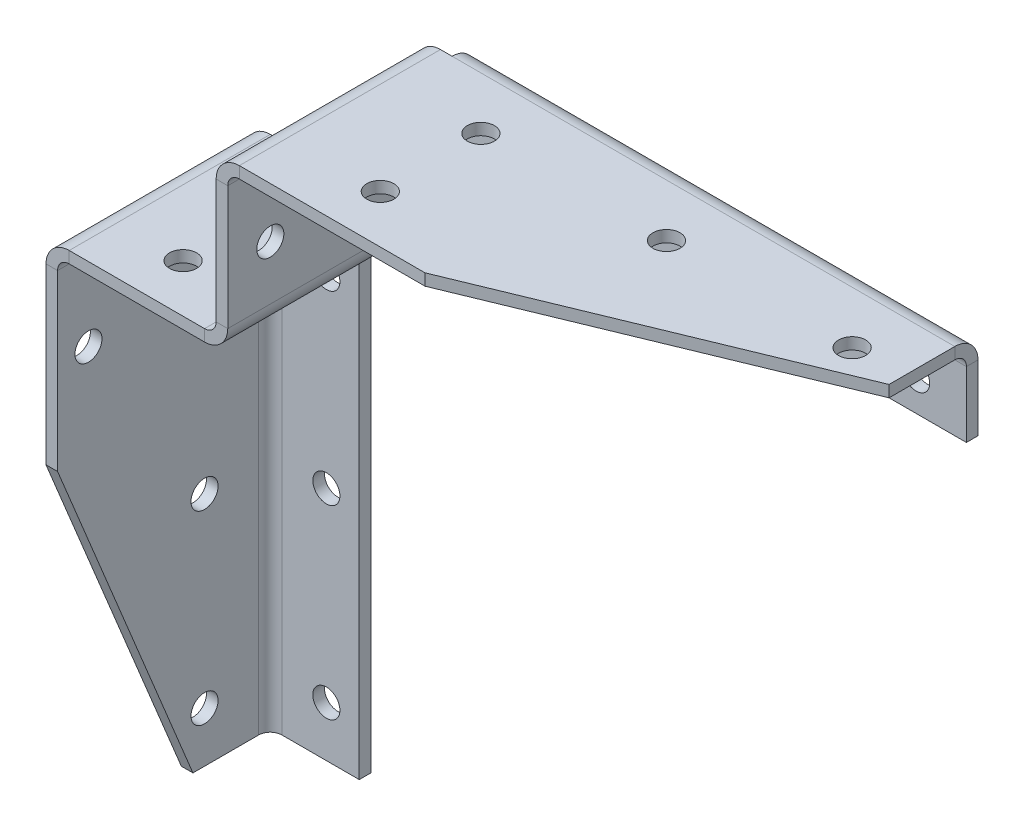
from build123d import *

# Parameters (mm, degrees)
SM_BASE_FLANGE_1_DEPTH           = 3
SM_EDGE_FLANGE_1_STRIP_W         = 18
SM_EDGE_FLANGE_1_STRIP_H         = 3
SM_EDGE_FLANGE_1_STRIP_CUT_DEPTH = 130
SM_EDGE_FLANGE_1_DEPTH           = 130
SM_EDGE_FLANGE_2_DEPTH           = 52
SM_EDGE_FLANGE_5_DEPTH           = 52
CUT_EXTRUDE_2_REACH              = 158.911
SKETCH_48_R                      = 3.5
CUT_EXTRUDE_3_REACH              = 150.997
SKETCH_49_R                      = 3.5
CUT_EXTRUDE_4_REACH              = 150.997
SKETCH_51_R                      = 3.5
SM_EDGE_FLANGE_6_DEPTH           = 52
CUT_EXTRUDE_5_REACH              = 263.117
SKETCH_59_R                      = 3.5
SM_EDGE_FLANGE_8_DEPTH           = 130
CUT_EXTRUDE_6_REACH              = 229.141
SKETCH_68_R                      = 3.5
CUT_EXTRUDE_7_REACH              = 198.876
SKETCH_69_R                      = 3.5


# Sheet-metal steps are written as plain solids
with BuildPart() as part:
    # Sketch 2 → Базовая кромка1 (new body)
    with BuildSketch(Plane(origin=(0, 0, 0), x_dir=(1, 0, 0), z_dir=(0, 1, 0))):
        Polygon((45, 55), (130, 55), (130, 35), (45, 0), (0, 0), (0, 55), align=None)
    extrude(amount=-SM_BASE_FLANGE_1_DEPTH)

    # Ребро-кромка1 strip (across the edge) → Ребро-кромка1 strip cut (cut)
    with BuildSketch(Plane(origin=(0, -3, -55), x_dir=(0, 0, 1), z_dir=(1, 0, 0))):
        with Locations((-6, -1.5)):
            Rectangle(SM_EDGE_FLANGE_1_STRIP_W, SM_EDGE_FLANGE_1_STRIP_H)
    extrude(amount=SM_EDGE_FLANGE_1_STRIP_CUT_DEPTH, mode=Mode.SUBTRACT)

    # Ребро-кромка1 section (across the edge) → Ребро-кромка1 (add)
    with BuildSketch(Plane(origin=(0, -3, -55), x_dir=(0, 0, 1), z_dir=(1, 0, 0))):
        with BuildLine():
            Line((-3, 3), (-3, 20))
            Line((-3, 20), (0, 20))
            Line((0, 20), (0, 3))
            ThreePointArc((0, 3), (0.878679656, 0.878679656), (3, 0))
            Line((3, 0), (3, -3))
            ThreePointArc((3, -3), (-1.242640687, -1.242640687), (-3, 3))
        make_face()
    extrude(amount=SM_EDGE_FLANGE_1_DEPTH)

    # Ребро-кромка2 section (across the edge) → Ребро-кромка2 (add)
    with BuildSketch(Plane(origin=(-6, -3, 0), x_dir=(1, 0, 0), z_dir=(0, 0, -1))):
        with BuildLine():
            Line((-3, 3), (-3, 35))
            Line((-3, 35), (0, 35))
            Line((0, 35), (0, 3))
            ThreePointArc((0, 3), (0.878679656, 0.878679656), (3, 0))
            Line((3, 0), (6, 0))
            Line((6, 0), (6, -3))
            Line((6, -3), (3, -3))
            ThreePointArc((3, -3), (-1.242640687, -1.242640687), (-3, 3))
        make_face()
    extrude(amount=SM_EDGE_FLANGE_2_DEPTH)

    # Ребро-кромка5 section (across the edge) → Ребро-кромка5 (add)
    with BuildSketch(Plane(origin=(-9, -41, -52), x_dir=(0, 1, 0), z_dir=(0, 0, 1))):
        with BuildLine():
            Line((-3, 3), (-3, 38))
            Line((-3, 38), (0, 38))
            Line((0, 38), (0, 3))
            ThreePointArc((0, 3), (0.878679656, 0.878679656), (3, 0))
            Line((3, 0), (3, -3))
            ThreePointArc((3, -3), (-1.242640687, -1.242640687), (-3, 3))
        make_face()
    extrude(amount=SM_EDGE_FLANGE_5_DEPTH)

    # Эскиз48 → Вырез-Вытянуть2 (cut, up to next)
    with BuildSketch(Plane.ZY.offset(9), mode=Mode.PRIVATE) as cut_extrude_2_sk1:
        with Locations(Location((-41, -24, 0), (0, 0, 270))):
            Circle(SKETCH_48_R)
    cut_extrude_2_tool1 = extrude(cut_extrude_2_sk1.sketch, amount=-CUT_EXTRUDE_2_REACH, mode=Mode.PRIVATE) & part.part
    # Эскиз48 → Вырез-Вытянуть2 (cut, up to next)
    with BuildSketch(Plane.ZY.offset(9), mode=Mode.PRIVATE) as cut_extrude_2_sk2:
        with Locations(Location((-11, -24, 0), (0, 0, 270))):
            Circle(SKETCH_48_R)
    cut_extrude_2_tool2 = extrude(cut_extrude_2_sk2.sketch, amount=-CUT_EXTRUDE_2_REACH, mode=Mode.PRIVATE) & part.part
    add(cut_extrude_2_tool1.solids().sort_by_distance((-9, -24, -41))[0], mode=Mode.SUBTRACT)
    add(cut_extrude_2_tool2.solids().sort_by_distance((-9, -24, -11))[0], mode=Mode.SUBTRACT)

    # Эскиз49 → Вырез-Вытянуть3 (cut, up to next)
    with BuildSketch(Plane(origin=(0, 0, 0), x_dir=(1, 0, 0), z_dir=(0, 1, 0)), mode=Mode.PRIVATE) as cut_extrude_3_sk1:
        with Locations(Location((21, 12.448418776, 0), (0, 0, 270))):
            Circle(SKETCH_49_R)
    cut_extrude_3_tool1 = extrude(cut_extrude_3_sk1.sketch, amount=-CUT_EXTRUDE_3_REACH, mode=Mode.PRIVATE) & part.part
    # Эскиз49 → Вырез-Вытянуть3 (cut, up to next)
    with BuildSketch(Plane(origin=(0, 0, 0), x_dir=(1, 0, 0), z_dir=(0, 1, 0)), mode=Mode.PRIVATE) as cut_extrude_3_sk2:
        with Locations(Location((21, 38.45, 0), (0, 0, 270))):
            Circle(SKETCH_49_R)
    cut_extrude_3_tool2 = extrude(cut_extrude_3_sk2.sketch, amount=-CUT_EXTRUDE_3_REACH, mode=Mode.PRIVATE) & part.part
    # Эскиз49 → Вырез-Вытянуть3 (cut, up to next)
    with BuildSketch(Plane(origin=(0, 0, 0), x_dir=(1, 0, 0), z_dir=(0, 1, 0)), mode=Mode.PRIVATE) as cut_extrude_3_sk3:
        with Locations(Location((117, 38.45, 0), (0, 0, 270))):
            Circle(SKETCH_49_R)
    cut_extrude_3_tool3 = extrude(cut_extrude_3_sk3.sketch, amount=-CUT_EXTRUDE_3_REACH, mode=Mode.PRIVATE) & part.part
    # Эскиз49 → Вырез-Вытянуть3 (cut, up to next)
    with BuildSketch(Plane(origin=(0, 0, 0), x_dir=(1, 0, 0), z_dir=(0, 1, 0)), mode=Mode.PRIVATE) as cut_extrude_3_sk4:
        with Locations(Location((69, 38.45, 0), (0, 0, 270))):
            Circle(SKETCH_49_R)
    cut_extrude_3_tool4 = extrude(cut_extrude_3_sk4.sketch, amount=-CUT_EXTRUDE_3_REACH, mode=Mode.PRIVATE) & part.part
    add(cut_extrude_3_tool1.solids().sort_by_distance((21, 0, -12.448419))[0], mode=Mode.SUBTRACT)
    add(cut_extrude_3_tool2.solids().sort_by_distance((21, 0, -38.45))[0], mode=Mode.SUBTRACT)
    add(cut_extrude_3_tool3.solids().sort_by_distance((117, 0, -38.45))[0], mode=Mode.SUBTRACT)
    add(cut_extrude_3_tool4.solids().sort_by_distance((69, 0, -38.45))[0], mode=Mode.SUBTRACT)

    # Эскиз51 → Вырез-Вытянуть4 (cut, up to next)
    with BuildSketch(Plane(origin=(0, 0, -58), x_dir=(-1, 0, 0), z_dir=(0, 0, -1)), mode=Mode.PRIVATE) as cut_extrude_4_sk1:
        with Locations(Location((-117, -14.5, 0), (0, 0, 90))):
            Circle(SKETCH_51_R)
    cut_extrude_4_tool1 = extrude(cut_extrude_4_sk1.sketch, amount=-CUT_EXTRUDE_4_REACH, mode=Mode.PRIVATE) & part.part
    # Эскиз51 → Вырез-Вытянуть4 (cut, up to next)
    with BuildSketch(Plane(origin=(0, 0, -58), x_dir=(-1, 0, 0), z_dir=(0, 0, -1)), mode=Mode.PRIVATE) as cut_extrude_4_sk2:
        with Locations(Location((-69, -14.5, 0), (0, 0, 90))):
            Circle(SKETCH_51_R)
    cut_extrude_4_tool2 = extrude(cut_extrude_4_sk2.sketch, amount=-CUT_EXTRUDE_4_REACH, mode=Mode.PRIVATE) & part.part
    # Эскиз51 → Вырез-Вытянуть4 (cut, up to next)
    with BuildSketch(Plane(origin=(0, 0, -58), x_dir=(-1, 0, 0), z_dir=(0, 0, -1)), mode=Mode.PRIVATE) as cut_extrude_4_sk3:
        with Locations(Location((-21, -14.5, 0), (0, 0, 90))):
            Circle(SKETCH_51_R)
    cut_extrude_4_tool3 = extrude(cut_extrude_4_sk3.sketch, amount=-CUT_EXTRUDE_4_REACH, mode=Mode.PRIVATE) & part.part
    add(cut_extrude_4_tool1.solids().sort_by_distance((117, -14.5, -58))[0], mode=Mode.SUBTRACT)
    add(cut_extrude_4_tool2.solids().sort_by_distance((69, -14.5, -58))[0], mode=Mode.SUBTRACT)
    add(cut_extrude_4_tool3.solids().sort_by_distance((21, -14.5, -58))[0], mode=Mode.SUBTRACT)

    # Ребро-кромка6 section (across the edge) → Ребро-кромка6 (add)
    with BuildSketch(Plane(origin=(-50, -44, 0), x_dir=(1, 0, 0), z_dir=(0, 0, -1))):
        with BuildLine():
            Line((-3, 3), (-3, 133))
            Line((-3, 133), (0, 133))
            Line((0, 133), (0, 3))
            ThreePointArc((0, 3), (0.878679656, 0.878679656), (3, 0))
            Line((3, 0), (3, -3))
            ThreePointArc((3, -3), (-1.242640687, -1.242640687), (-3, 3))
        make_face()
    extrude(amount=SM_EDGE_FLANGE_6_DEPTH)

    # Эскиз59 → Вырез-Вытянуть5 (cut, up to next)
    with BuildSketch(Plane.ZY.offset(53), mode=Mode.PRIVATE) as cut_extrude_5_sk1:
        with Locations(Location((-7.981818004, -68, 0), (0, 0, 270))):
            Circle(SKETCH_59_R)
    cut_extrude_5_tool1 = extrude(cut_extrude_5_sk1.sketch, amount=-CUT_EXTRUDE_5_REACH, mode=Mode.PRIVATE) & part.part
    # Эскиз59 → Вырез-Вытянуть5 (cut, up to next)
    with BuildSketch(Plane.ZY.offset(53), mode=Mode.PRIVATE) as cut_extrude_5_sk2:
        with Locations(Location((-37.994919226, -68, 0), (0, 0, 270))):
            Circle(SKETCH_59_R)
    cut_extrude_5_tool2 = extrude(cut_extrude_5_sk2.sketch, amount=-CUT_EXTRUDE_5_REACH, mode=Mode.PRIVATE) & part.part
    # Эскиз59 → Вырез-Вытянуть5 (cut, up to next)
    with BuildSketch(Plane.ZY.offset(53), mode=Mode.PRIVATE) as cut_extrude_5_sk3:
        with Locations(Location((-37.994919226, -116, 0), (0, 0, 270))):
            Circle(SKETCH_59_R)
    cut_extrude_5_tool3 = extrude(cut_extrude_5_sk3.sketch, amount=-CUT_EXTRUDE_5_REACH, mode=Mode.PRIVATE) & part.part
    # Эскиз59 → Вырез-Вытянуть5 (cut, up to next)
    with BuildSketch(Plane.ZY.offset(53), mode=Mode.PRIVATE) as cut_extrude_5_sk4:
        with Locations(Location((-37.994919226, -164, 0), (0, 0, 270))):
            Circle(SKETCH_59_R)
    cut_extrude_5_tool4 = extrude(cut_extrude_5_sk4.sketch, amount=-CUT_EXTRUDE_5_REACH, mode=Mode.PRIVATE) & part.part
    # Эскиз59 → Вырез-Вытянуть5 (cut, up to next)
    with BuildSketch(Plane.ZY.offset(53), mode=Mode.PRIVATE) as cut_extrude_5_sk5:
        Polygon((0, -92), (-35, -177), (0, -177), align=None)
    cut_extrude_5_tool5 = extrude(cut_extrude_5_sk5.sketch, amount=-CUT_EXTRUDE_5_REACH, mode=Mode.PRIVATE) & part.part
    add(cut_extrude_5_tool1.solids().sort_by_distance((-53, -68, -7.981818))[0], mode=Mode.SUBTRACT)
    add(cut_extrude_5_tool2.solids().sort_by_distance((-53, -68, -37.994919))[0], mode=Mode.SUBTRACT)
    add(cut_extrude_5_tool3.solids().sort_by_distance((-53, -116, -37.994919))[0], mode=Mode.SUBTRACT)
    add(cut_extrude_5_tool4.solids().sort_by_distance((-53, -164, -37.994919))[0], mode=Mode.SUBTRACT)
    add(cut_extrude_5_tool5.solids().sort_by_distance((-53, -148.666667, -11.666667))[0], mode=Mode.SUBTRACT)

    # Ребро-кромка8 section (across the edge) → Ребро-кромка8 (add)
    with BuildSketch(Plane(origin=(-50, -177, -55), x_dir=(0, 0, 1), z_dir=(0, 1, 0))):
        with BuildLine():
            Line((-3, 3), (-3, 23))
            Line((-3, 23), (0, 23))
            Line((0, 23), (0, 3))
            ThreePointArc((0, 3), (0.878679656, 0.878679656), (3, 0))
            Line((3, 0), (3, -3))
            ThreePointArc((3, -3), (-1.242640687, -1.242640687), (-3, 3))
        make_face()
    extrude(amount=SM_EDGE_FLANGE_8_DEPTH)

    # Эскиз68 → Вырез-Вытянуть6 (cut, up to next)
    with BuildSketch(Plane(origin=(0, 0, -58), x_dir=(-1, 0, 0), z_dir=(0, 0, -1)), mode=Mode.PRIVATE) as cut_extrude_6_sk1:
        with Locations((35.5, -68)):
            Circle(SKETCH_68_R)
    cut_extrude_6_tool1 = extrude(cut_extrude_6_sk1.sketch, amount=-CUT_EXTRUDE_6_REACH, mode=Mode.PRIVATE) & part.part
    # Эскиз68 → Вырез-Вытянуть6 (cut, up to next)
    with BuildSketch(Plane(origin=(0, 0, -58), x_dir=(-1, 0, 0), z_dir=(0, 0, -1)), mode=Mode.PRIVATE) as cut_extrude_6_sk2:
        with Locations((35.5, -116)):
            Circle(SKETCH_68_R)
    cut_extrude_6_tool2 = extrude(cut_extrude_6_sk2.sketch, amount=-CUT_EXTRUDE_6_REACH, mode=Mode.PRIVATE) & part.part
    # Эскиз68 → Вырез-Вытянуть6 (cut, up to next)
    with BuildSketch(Plane(origin=(0, 0, -58), x_dir=(-1, 0, 0), z_dir=(0, 0, -1)), mode=Mode.PRIVATE) as cut_extrude_6_sk3:
        with Locations((35.5, -164)):
            Circle(SKETCH_68_R)
    cut_extrude_6_tool3 = extrude(cut_extrude_6_sk3.sketch, amount=-CUT_EXTRUDE_6_REACH, mode=Mode.PRIVATE) & part.part
    add(cut_extrude_6_tool1.solids().sort_by_distance((-35.5, -68, -58))[0], mode=Mode.SUBTRACT)
    add(cut_extrude_6_tool2.solids().sort_by_distance((-35.5, -116, -58))[0], mode=Mode.SUBTRACT)
    add(cut_extrude_6_tool3.solids().sort_by_distance((-35.5, -164, -58))[0], mode=Mode.SUBTRACT)

    # Эскиз69 → Вырез-Вытянуть7 (cut, up to next)
    with BuildSketch(Plane(origin=(0, -41, 0), x_dir=(1, 0, 0), z_dir=(0, 1, 0)), mode=Mode.PRIVATE) as cut_extrude_7_sk1:
        with Locations(Location((-30, 42.45, 0), (0, 0, 270))):
            Circle(SKETCH_69_R)
    cut_extrude_7_tool1 = extrude(cut_extrude_7_sk1.sketch, amount=-CUT_EXTRUDE_7_REACH, mode=Mode.PRIVATE) & part.part
    # Эскиз69 → Вырез-Вытянуть7 (cut, up to next)
    with BuildSketch(Plane(origin=(0, -41, 0), x_dir=(1, 0, 0), z_dir=(0, 1, 0)), mode=Mode.PRIVATE) as cut_extrude_7_sk2:
        with Locations(Location((-30, 12.45, 0), (0, 0, 270))):
            Circle(SKETCH_69_R)
    cut_extrude_7_tool2 = extrude(cut_extrude_7_sk2.sketch, amount=-CUT_EXTRUDE_7_REACH, mode=Mode.PRIVATE) & part.part
    add(cut_extrude_7_tool1.solids().sort_by_distance((-30, -41, -42.45))[0], mode=Mode.SUBTRACT)
    add(cut_extrude_7_tool2.solids().sort_by_distance((-30, -41, -12.45))[0], mode=Mode.SUBTRACT)


solid = part.part
